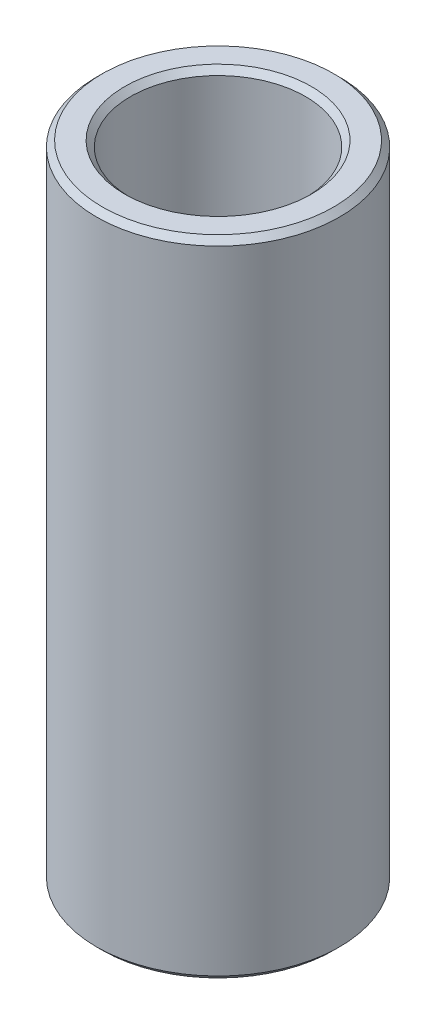
from build123d import *

# Parameters (mm, degrees)
SKETCH1_R           = 42.5
BOSS_EXTRUDE1_DEPTH = 225.344528679
SKETCH2_R           = 30.642586612
CUT_EXTRUDE1_DEPTH  = 234.222332991
CHAMFER1_SIZE       = 2.031799439


with BuildPart() as part:
    # Sketch1 → Boss-Extrude1 (new body)
    with BuildSketch(Plane(origin=(0, 0, 0), x_dir=(1, 0, 0), z_dir=(0, 1, 0))):
        Circle(SKETCH1_R)
    extrude(amount=BOSS_EXTRUDE1_DEPTH)

    # Sketch2 → Cut-Extrude1 (cut, through all)
    with BuildSketch(Plane(origin=(0, 0, 0), x_dir=(1, 0, 0), z_dir=(0, 1, 0))):
        Circle(SKETCH2_R)
    extrude(amount=CUT_EXTRUDE1_DEPTH, mode=Mode.SUBTRACT)

    # Chamfer1
    chamfer1_edges = [part.edges().sort_by_distance(p)[0] for p in [
        (-30.642586612, 225.344528679, 0),
        (-30.642586612, 0, 0),
        (-42.5, 0, 0),
        (-42.5, 225.344528679, 0),
    ]]
    chamfer(chamfer1_edges, length=CHAMFER1_SIZE)


solid = part.part
